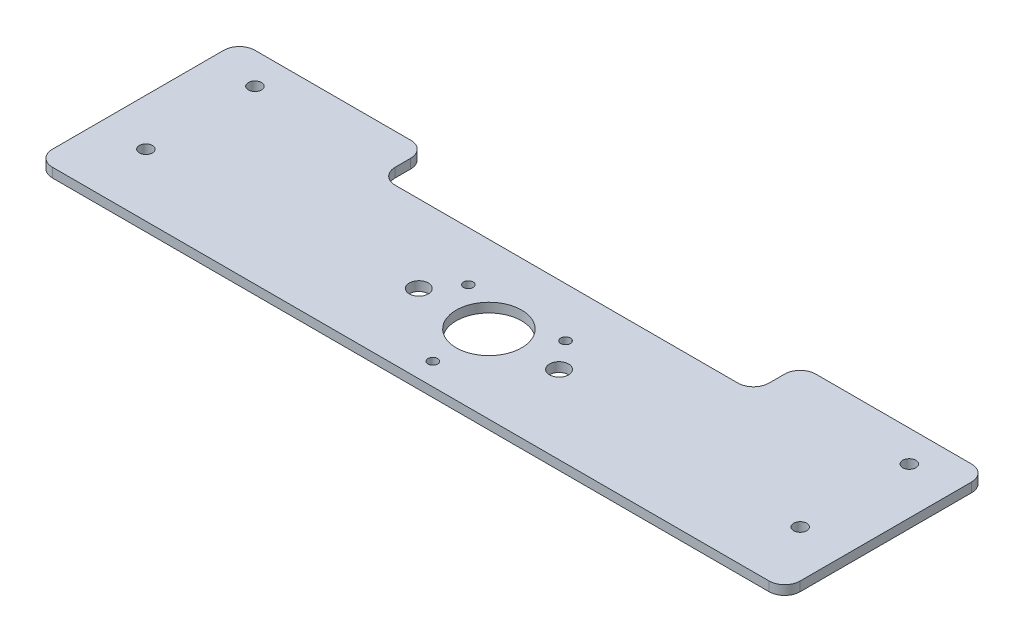
from build123d import *

# Parameters (mm, degrees)
SKETCH_1_R          = 2.1
EXTRUDE_1_DEPTH     = 3
SKETCH_2_W          = 120
SKETCH_2_H          = 15
CUT_EXTRUDE_1_DEPTH = 3
FILLET_1_R          = 5
SKETCH_3_R          = 10.5
SKETCH_3_R_2        = 1.55
CUT_EXTRUDE_2_DEPTH = 32
SKETCH_4_R          = 3.05
CUT_EXTRUDE_3_DEPTH = 10


with BuildPart() as part:
    # 草图1 → 凸台-拉伸1 (new body)
    with BuildSketch(Plane(origin=(0, 0, 0), x_dir=(1, 0, 0), z_dir=(0, 1, 0))):
        Polygon((-120, 57.5), (-120, -7.5), (-60, -7.5), (20, -7.5), (120, -7.5), (120, 57.5), align=None)
        with Locations((-105, 12.5)):
            Circle(SKETCH_1_R, mode=Mode.SUBTRACT)
        with Locations((105, 12.5)):
            Circle(SKETCH_1_R, mode=Mode.SUBTRACT)
        with Locations((-105, 47.5)):
            Circle(SKETCH_1_R, mode=Mode.SUBTRACT)
        with Locations((105, 47.5)):
            Circle(SKETCH_1_R, mode=Mode.SUBTRACT)
    extrude(amount=EXTRUDE_1_DEPTH)

    # 草图2 → 切除-拉伸1 (cut)
    with BuildSketch(Plane(origin=(0, 3, 0), x_dir=(1, 0, 0), z_dir=(0, 1, 0))):
        with Locations((0, 50)):
            Rectangle(SKETCH_2_W, SKETCH_2_H)
    extrude(amount=-CUT_EXTRUDE_1_DEPTH, mode=Mode.SUBTRACT)

    # 圆角1
    fillet_1_edges = [part.edges().sort_by_distance(p)[0] for p in [
        (120, 1.5, 7.5),
        (-120, 1.5, 7.5),
        (-120, 1.5, -57.5),
        (120, 1.5, -57.5),
        (60, 1.5, -57.5),
        (60, 1.5, -42.5),
        (-60, 1.5, -42.5),
        (-60, 1.5, -57.5),
    ]]
    fillet(fillet_1_edges, radius=FILLET_1_R)

    # 草图3 → 切除-拉伸2 (cut)
    with BuildSketch(Plane(origin=(0, 3, 0), x_dir=(1, 0, 0), z_dir=(0, 1, 0))):
        with Locations((0, 17.593406236)):
            Circle(SKETCH_3_R)
        with Locations((0, -0.406593764)):
            Circle(SKETCH_3_R_2)
        with Locations((-15.588457268, 26.593406236)):
            Circle(SKETCH_3_R_2)
        with Locations((15.588457268, 26.593406236)):
            Circle(SKETCH_3_R_2)
    extrude(amount=-CUT_EXTRUDE_2_DEPTH, mode=Mode.SUBTRACT)

    # 草图4 → 切除-拉伸3 (cut)
    with BuildSketch(Plane(origin=(0, 3, 0), x_dir=(1, 0, 0), z_dir=(0, 1, 0))):
        with Locations((-22.5, 17.593406236)):
            Circle(SKETCH_4_R)
        with Locations((22.5, 17.593406236)):
            Circle(SKETCH_4_R)
    extrude(amount=-CUT_EXTRUDE_3_DEPTH, mode=Mode.SUBTRACT)


solid = part.part
